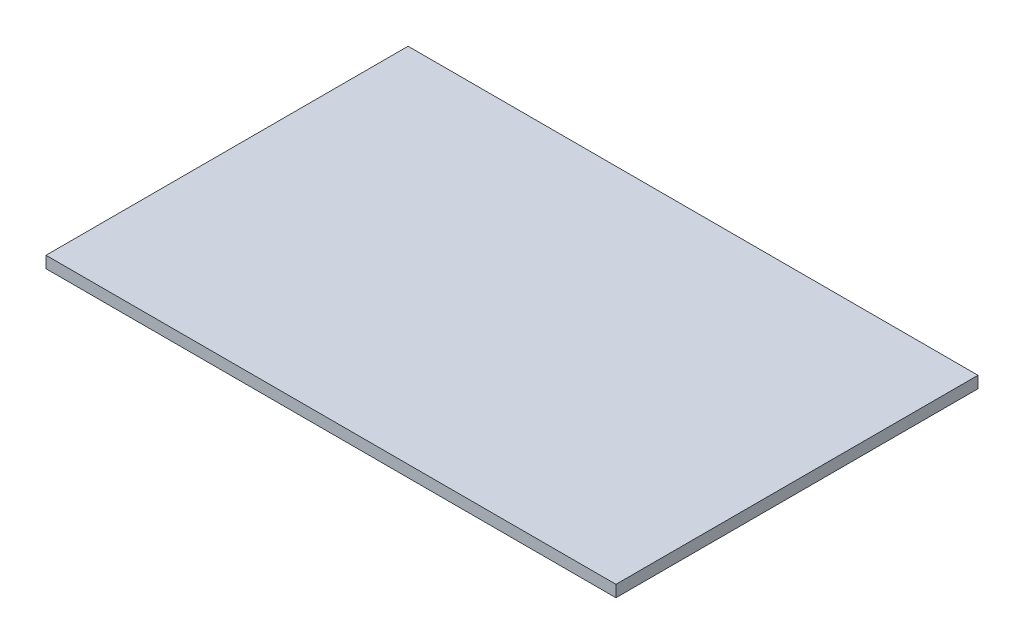
from build123d import *

# Parameters (mm, degrees)
SKETCH_1_W      = 244
SKETCH_1_H      = 155
EXTRUDE_1_DEPTH = 5


with BuildPart() as part:
    # 草图1 → 凸台-拉伸1 (new body)
    with BuildSketch(Plane(origin=(0, 0, 0), x_dir=(1, 0, 0), z_dir=(0, 1, 0))):
        with Locations((122, -77.5)):
            Rectangle(SKETCH_1_W, SKETCH_1_H)
    extrude(amount=EXTRUDE_1_DEPTH)


solid = part.part
